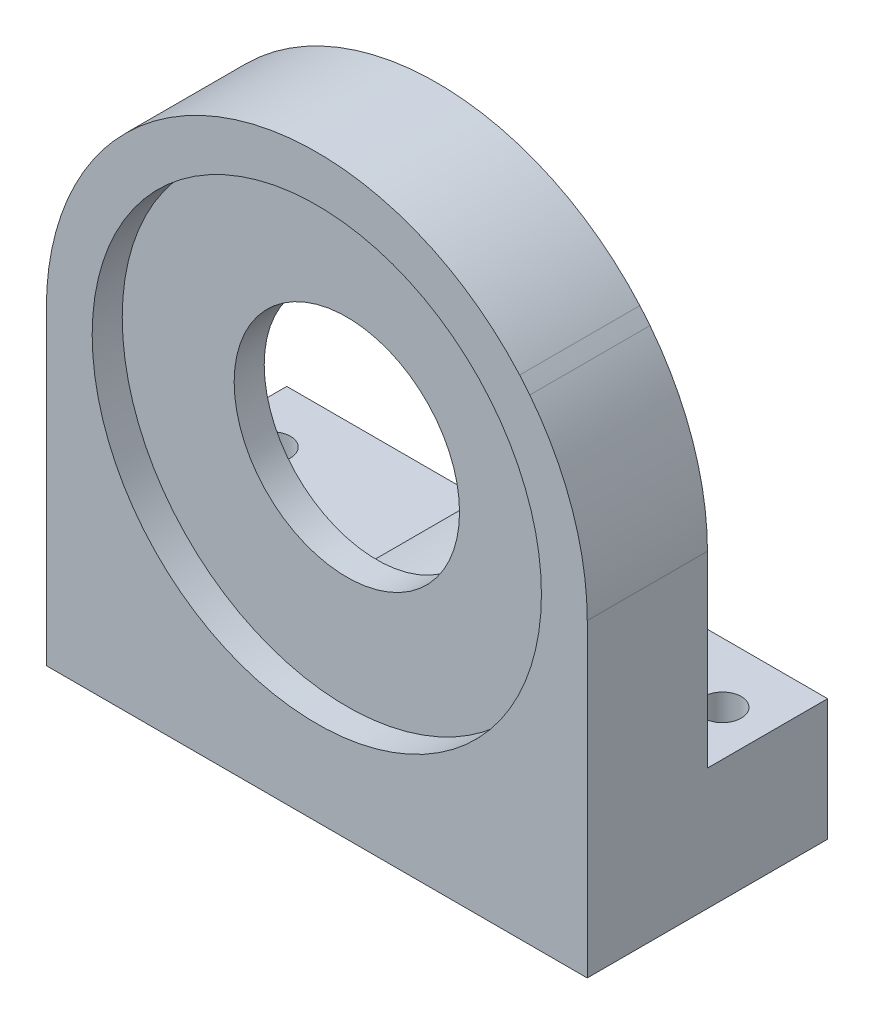
from build123d import *
from build123d.topology import SkipClean

# Parameters (mm, degrees)
ESBO_O1_R                     = 18
ESBO_O1_R_2                   = 14.95
RESSALTO_EXTRUS_O1_DEPTH      = 2
ESBO_O16_R                    = 7.5
RESSALTO_EXTRUS_O5_DEPTH      = 2
ESBO_O17_W                    = 48
ESBO_O17_H                    = 12
RESSALTO_EXTRUS_O6_DEPTH      = 8.1
CHANFRO1_SIZE                 = 12
CHANFRO1_SIZE_2               = 12.5
FILETE3_R                     = 44
CORTE_EXTRUS_O11_REACH        = 37.445
CORTE_EXTRUS_O12_REACH        = 31.872
FURO_ROSCADO_DE_M3X0_51_D     = 2.5
FURO_ROSCADO_DE_M3X0_51_DEPTH = 8.5
FURO_ROSCADO_DE_M3X0_51_TIP   = 0.751075774
CORTE_EXTRUS_O13_DEPTH        = 32.691639276
CORTE_EXTRUS_O13_DEPTH_BACK   = 32.691639276
RESSALTO_EXTRUS_O7_DEPTH      = 12
CORTE_EXTRUS_O15_START        = -12
ESBO_O26_R                    = 13.5
CORTE_EXTRUS_O15_DEPTH        = 12
RESSALTO_EXTRUS_O8_START      = -4
RESSALTO_EXTRUS_O8_DEPTH      = 4
RESSALTO_EXTRUS_O9_START      = -4
RESSALTO_EXTRUS_O9_DEPTH      = 4


with BuildPart() as part:
    # Esboço1 → Ressalto-extrusão1 (new body)
    # profile 1 of 2: a face of its own
    with BuildSketch(Plane.XY):
        Circle(ESBO_O1_R)
        Circle(ESBO_O1_R_2, mode=Mode.SUBTRACT)
    # profile 2 of 2: a face of its own
    with BuildSketch(Plane.XY):
        with BuildLine():
            Line((24, -20.6), (24, 0))
            Line((24, 0), (13.5, 11.9058809))
            ThreePointArc((13.5, 11.9058809), (16.83745824, 6.363961031), (18, 0))
            ThreePointArc((18, 0), (-6.363961031, -16.83745824), (-13.5, 11.9058809))
            Line((-13.5, 11.9058809), (-24, 0))
            Line((-24, 0), (-24, -20.6))
            Line((-24, -20.6), (-18, -20.6))
            Line((-18, -20.6), (18, -20.6))
            Line((18, -20.6), (24, -20.6))
        make_face()
    extrude(amount=-RESSALTO_EXTRUS_O1_DEPTH)

    # Esboço16 → Ressalto-extrusão5 (add)
    with BuildSketch(Plane(origin=(0, 0, -2), x_dir=(-1, 0, 0), z_dir=(0, 0, -1))):
        with BuildLine():
            Line((-13.5, 11.9058809), (-24, 0))
            Line((-24, 0), (-24, -20.6))
            Line((-24, -20.6), (24, -20.6))
            Line((24, -20.6), (24, 0))
            Line((24, 0), (13.5, 11.9058809))
            ThreePointArc((13.5, 11.9058809), (0, 18), (-13.5, 11.9058809))
        make_face()
        Circle(ESBO_O16_R, mode=Mode.SUBTRACT)
    extrude(amount=RESSALTO_EXTRUS_O5_DEPTH)

    # Esboço17 → Ressalto-extrusão6 (add)
    with BuildSketch(Plane.XZ.offset(20.6)):
        with Locations((0, -10)):
            Rectangle(ESBO_O17_W, ESBO_O17_H)
    extrude(amount=-RESSALTO_EXTRUS_O6_DEPTH)

    # Chanfro1
    # the kernel refuses this chamfer: 12.5, 12 mm, written as the material it adds along each edge
    with BuildSketch(Plane(origin=(-24, -12.5, -4), x_dir=(0, 0, -1), z_dir=(1, 0, 0))) as chanfro1_piece_1_section:
        Polygon((CHANFRO1_SIZE, 0), (0, CHANFRO1_SIZE_2), (0, 0), align=None)
    chanfro1_piece_1 = extrude(amount=48, mode=Mode.PRIVATE)
    chanfro1_piece_1 = split(chanfro1_piece_1, bisect_by=Plane(origin=(-24, -12.5, -16), z_dir=(0, 0, 1)), keep=Keep.TOP, mode=Mode.PRIVATE)
    chanfro1_piece_1 = split(chanfro1_piece_1, bisect_by=Plane(origin=(9.200979635, 16.7805118, -4), z_dir=(-0.7499999999999999, -0.6614378277661479, 0)), keep=Keep.TOP, mode=Mode.PRIVATE)
    chanfro1_piece_1 = chanfro1_piece_1 - Plane(origin=(0, 0, -4), x_dir=(-1, 0, 0), z_dir=(0, 0, 1)) * Cylinder(7.5, 146, mode=Mode.PRIVATE)
    add(chanfro1_piece_1)

    # Filete3
    # the kernel refuses this fillet: 44 mm, written as the material it takes off along each edge
    with BuildSketch(Plane(origin=(-24, 0, -45.551056879), x_dir=(0, -1, 0), z_dir=(0, 0, 1))) as filete3_piece_1:
        with BuildLine():
            CenterArc((16.620422751, 44), FILETE3_R, 229.584560979, 40.415439021)
            Line((-11.9058809, 10.5), (0, 0))
            Line((0, 0), (16.620422751, 0))
        make_face()
    extrude(amount=87.102113757, mode=Mode.SUBTRACT)
    with BuildSketch(Plane(origin=(24, 0, 41.551056879), x_dir=(-0.6614378277661485, 0.7499999999999993, -1.154178375495321e-15), z_dir=(0, 0, -1))) as filete3_piece_2:
        with BuildLine():
            CenterArc((16.637947358, -43.993376321), FILETE3_R, 90.994183088, 40.415439021)
            Line((-12.465317064, -10.993376321), (0, 0))
            Line((0, 0), (15.874507866, 0))
        make_face()
    extrude(amount=87.102113757, mode=Mode.SUBTRACT)

    # Esboço18 → Corte-extrusão11 (cut, up to next)
    with BuildSketch(Plane.XY, mode=Mode.PRIVATE) as corte_extrus_o11_sk1:
        with BuildLine():
            Line((18, 0), (18, -20.6))
            Line((18, -20.6), (24, -20.6))
            Line((24, -20.6), (24, -16.620422751))
            ThreePointArc((24, -16.620422751), (21.471204393, -1.918749165), (14.175490626, 11.093036803))
            ThreePointArc((14.175490626, 11.093036803), (17.017033103, 5.86690586), (18, 0))
        make_face()
    corte_extrus_o11_tool1 = extrude(corte_extrus_o11_sk1.sketch, amount=-CORTE_EXTRUS_O11_REACH, mode=Mode.PRIVATE) & part.part
    # Esboço18 → Corte-extrusão11 (cut, up to next)
    with BuildSketch(Plane.XY, mode=Mode.PRIVATE) as corte_extrus_o11_sk2:
        with BuildLine():
            Line((-18, -20.6), (-18, 0))
            ThreePointArc((-18, 0), (-17.017033103, 5.86690586), (-14.175490626, 11.093036803))
            ThreePointArc((-14.175490626, 11.093036803), (-21.471204393, -1.918749165), (-24, -16.620422751))
            Line((-24, -16.620422751), (-24, -20.6))
            Line((-24, -20.6), (-18, -20.6))
        make_face()
    corte_extrus_o11_tool2 = extrude(corte_extrus_o11_sk2.sketch, amount=-CORTE_EXTRUS_O11_REACH, mode=Mode.PRIVATE) & part.part
    add(corte_extrus_o11_tool1.solids().sort_by_distance((20.438878, -9.921074, 0))[0], mode=Mode.SUBTRACT)
    add(corte_extrus_o11_tool2.solids().sort_by_distance((-20.438878, -9.921074, 0))[0], mode=Mode.SUBTRACT)

    # Esboço19 → Corte-extrusão12 (cut, up to next)
    with BuildSketch(Plane(origin=(0, 0, -4), x_dir=(-1, 0, 0), z_dir=(0, 0, -1)), mode=Mode.PRIVATE) as corte_extrus_o12_sk1:
        with BuildLine():
            Line((12, -20.6), (13.462552863, -1.004823575))
            ThreePointArc((13.462552863, -1.004823575), (0, 13.5), (-13.462552863, -1.004823575))
            Line((-13.462552863, -1.004823575), (-12, -20.6))
            Line((-12, -20.6), (12, -20.6))
        make_face()
    corte_extrus_o12_tool1 = extrude(corte_extrus_o12_sk1.sketch, amount=CORTE_EXTRUS_O12_REACH, mode=Mode.PRIVATE) & part.part
    add(corte_extrus_o12_tool1.solids().sort_by_distance((0, -4.517343, -4))[0], mode=Mode.SUBTRACT)

    # Furo roscado de M3x0.51
    with Locations(Plane.XZ.offset(20.6)):
        with Locations((-15, -12), (-15, -4), (15, -4), (15, -12)):
            Hole(FURO_ROSCADO_DE_M3X0_51_D / 2, depth=FURO_ROSCADO_DE_M3X0_51_DEPTH)
            with Locations((0, 0, -(FURO_ROSCADO_DE_M3X0_51_DEPTH + FURO_ROSCADO_DE_M3X0_51_TIP / 2))):  # 118° drill point
                Cone(0, FURO_ROSCADO_DE_M3X0_51_D / 2, FURO_ROSCADO_DE_M3X0_51_TIP, mode=Mode.SUBTRACT)

    # Esboço23 → Corte-extrusão13 (cut, two sides: drawn at the far end of the back side and taken through both)
    with BuildSketch(Plane(origin=(0, 0, 0), x_dir=(0, 0, -1), z_dir=(1, 0, 0)).offset(-CORTE_EXTRUS_O13_DEPTH_BACK)):
        Polygon((16, -12.5), (8, -12.5), (8, -4.166666667), align=None)
    extrude(amount=CORTE_EXTRUS_O13_DEPTH + CORTE_EXTRUS_O13_DEPTH_BACK, mode=Mode.SUBTRACT)

    # Esboço24 → Ressalto-extrusão7 (add)
    with BuildSketch(Plane(origin=(0, 0, -4), x_dir=(-1, 0, 0), z_dir=(0, 0, -1))):
        Polygon((-12, -20.6), (12, -20.6), (12.604571142, -12.5), (-12.604571142, -12.5), align=None)
    extrude(amount=RESSALTO_EXTRUS_O7_DEPTH)

    # Esboço26 → Corte-extrusão15 (cut)
    with BuildSketch(Plane(origin=(0, 0, -16), x_dir=(-1, 0, 0), z_dir=(0, 0, -1)).offset(CORTE_EXTRUS_O15_START)):
        Circle(ESBO_O26_R)
    extrude(amount=CORTE_EXTRUS_O15_DEPTH, mode=Mode.SUBTRACT)

    # Esboço27 → Ressalto-extrusão8 (add)
    with SkipClean():  # the faces are left unmerged after this step: merging them gives an invalid solid
        with BuildSketch(Plane(origin=(0, 0, -8), x_dir=(-1, 0, 0), z_dir=(0, 0, -1)).offset(RESSALTO_EXTRUS_O8_START)):
            with BuildLine():
                Line((-12.604571142, -12.5), (-5.099019514, -12.5))
                ThreePointArc((-5.099019514, -12.5), (-10.916398789, -7.942432717), (-13.462552863, -1.004823575))
                Line((-13.462552863, -1.004823575), (-13.226557914, -4.166666667))
                Line((-13.226557914, -4.166666667), (-12.604571142, -12.5))
            make_face()
            with BuildLine():
                Line((5.099019514, -12.5), (12.604571142, -12.5))
                Line((12.604571142, -12.5), (13.462552863, -1.004823575))
                ThreePointArc((13.462552863, -1.004823575), (10.916398789, -7.942432717), (5.099019514, -12.5))
            make_face()
        extrude(amount=RESSALTO_EXTRUS_O8_DEPTH)

    # Esboço28 → Ressalto-extrusão9 (add)
    with SkipClean():  # the faces are left unmerged after this step: merging them gives an invalid solid
        with BuildSketch(Plane(origin=(0, 0, -8), x_dir=(-1, 0, 0), z_dir=(0, 0, -1)).offset(RESSALTO_EXTRUS_O9_START)):
            with BuildLine():
                Line((13.462552863, -1.004823575), (13.226557914, -4.166666667))
                Line((13.226557914, -4.166666667), (18, -4.166666667))
                Line((18, -4.166666667), (18, 0))
                ThreePointArc((18, 0), (17.017033103, 5.86690586), (14.175490626, 11.093036803))
                ThreePointArc((14.175490626, 11.093036803), (13.840185974, 11.501487092), (13.5, 11.9058809))
                ThreePointArc((13.5, 11.9058809), (0, 18), (-13.5, 11.9058809))
                ThreePointArc((-13.5, 11.9058809), (-13.840185974, 11.501487092), (-14.175490626, 11.093036803))
                ThreePointArc((-14.175490626, 11.093036803), (-17.017033103, 5.86690586), (-18, 0))
                Line((-18, 0), (-18, -4.166666667))
                Line((-18, -4.166666667), (-13.226557914, -4.166666667))
                Line((-13.226557914, -4.166666667), (-13.462552863, -1.004823575))
                ThreePointArc((-13.462552863, -1.004823575), (-0.502760556, 13.490634967), (13.5, 0))
                ThreePointArc((13.5, 0), (13.490634967, -0.502760556), (13.462552863, -1.004823575))
            make_face()
        extrude(amount=RESSALTO_EXTRUS_O9_DEPTH)


solid = part.part
